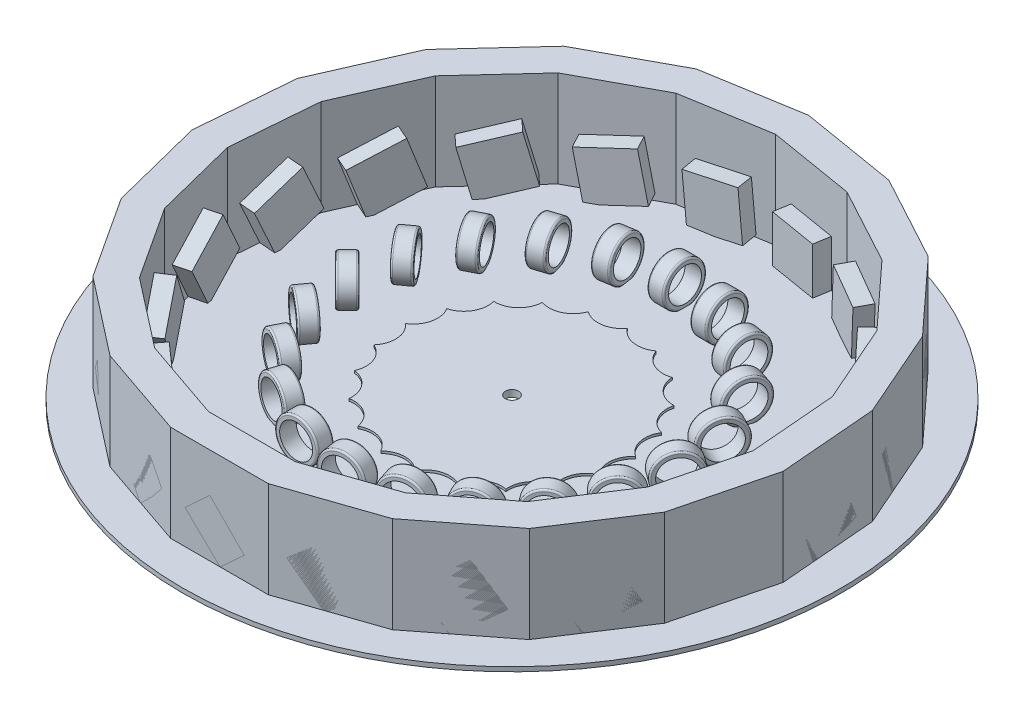
from build123d import *

# Parameters (mm, degrees)
SKETCH1_R                 = 100
SKETCH1_R_2               = 2.0000000000000018
BASE_PLATTER_DEPTH        = 0.75
SKETCH2_R                 = 2
INNER_DESIGN_DEPTH        = 1.3
CUBE_FACE_REFERENCE_DEPTH = 29.800000000000015
FIRST_CUBE_DEPTH          = 14.82
BOSS_EXTRUDE6_DEPTH       = 14.82
BOSS_EXTRUDE7_DEPTH       = 14.82
BOSS_EXTRUDE9_DEPTH       = 14.82
BOSS_EXTRUDE10_DEPTH      = 14.82
BOSS_EXTRUDE11_DEPTH      = 14.82
BOSS_EXTRUDE12_DEPTH      = 14.82
BOSS_EXTRUDE14_DEPTH      = 14.82
BOSS_EXTRUDE15_DEPTH      = 14.82
BOSS_EXTRUDE16_DEPTH      = 14.82
BOSS_EXTRUDE18_DEPTH      = 14.82
BOSS_EXTRUDE19_DEPTH      = 14.82
BOSS_EXTRUDE20_DEPTH      = 14.82
BOSS_EXTRUDE21_DEPTH      = 14.82
BOSS_EXTRUDE23_DEPTH      = 14.82
BOSS_EXTRUDE24_DEPTH      = 14.82
BOSS_EXTRUDE25_DEPTH      = 14.82
BOSS_EXTRUDE26_DEPTH      = 14.82
BOSS_EXTRUDE27_DEPTH      = 14.82
RINGS_DEPTH               = 13
SKETCH23_W                = 5.000000000000001
SKETCH23_H                = 13
RINGS_2_DEPTH             = 13
RINGS_3_DEPTH             = 13
RINGS_4_DEPTH             = 13
RINGS_5_DEPTH             = 13
RINGS_6_DEPTH             = 13
RINGS_7_DEPTH             = 13
RINGS_8_DEPTH             = 13
RINGS_9_DEPTH             = 13
RINGS_10_DEPTH            = 13
RINGS_11_DEPTH            = 13
RINGS_12_DEPTH            = 13
RINGS_13_DEPTH            = 13
RINGS_14_DEPTH            = 13
RINGS_15_DEPTH            = 13
RINGS_16_DEPTH            = 13
RINGS_17_DEPTH            = 13
RINGS_18_DEPTH            = 13
RINGS_19_DEPTH            = 13
RINGS_20_DEPTH            = 13
SKETCH26_R                = 4.999999999999997
CUT_EXTRUDE2_DEPTH        = 5
SKETCH27_R                = 4.999999999999997
CUT_EXTRUDE3_DEPTH        = 5
SKETCH28_R                = 4.999999999999997
CUT_EXTRUDE4_DEPTH        = 5
SKETCH29_R                = 4.999999999999997
CUT_EXTRUDE5_DEPTH        = 5
SKETCH30_R                = 4.999999999999997
CUT_EXTRUDE6_DEPTH        = 5
SKETCH31_R                = 4.999999999999997
CUT_EXTRUDE7_DEPTH        = 5
SKETCH32_R                = 4.999999999999997
CUT_EXTRUDE8_DEPTH        = 5
SKETCH33_R                = 5
CUT_EXTRUDE9_DEPTH        = 5
SKETCH34_R                = 4.999999999999998
CUT_EXTRUDE10_DEPTH       = 5
SKETCH35_R                = 4.999999999999998
CUT_EXTRUDE11_DEPTH       = 5
SKETCH36_R                = 5.000000000000003
CUT_EXTRUDE12_DEPTH       = 5
SKETCH37_R                = 5.0000000000000036
CUT_EXTRUDE13_DEPTH       = 5
SKETCH38_R                = 5
CUT_EXTRUDE14_DEPTH       = 5
SKETCH39_R                = 4.999999999999997
CUT_EXTRUDE15_DEPTH       = 5
SKETCH40_R                = 5
CUT_EXTRUDE16_DEPTH       = 5
SKETCH41_R                = 5
CUT_EXTRUDE17_DEPTH       = 5
SKETCH42_R                = 5.000000000000004
CUT_EXTRUDE18_DEPTH       = 5
SKETCH43_R                = 4.999999999999997
CUT_EXTRUDE19_DEPTH       = 5
SKETCH44_R                = 4.999999999999997
CUT_EXTRUDE20_DEPTH       = 5
SKETCH45_R                = 4.999999999999997
CUT_EXTRUDE21_DEPTH       = 5
SKETCH46_R                = 100
SKETCH46_R_2              = 2
BOSS_EXTRUDE29_DEPTH      = 0.6
FILLET1_R                 = 0.5


with BuildPart() as part:
    # Sketch1 → Base Platter (new body)
    with BuildSketch(Plane(origin=(0, 0, 0), x_dir=(1, 0, 0), z_dir=(0, 1, 0))):
        with Locations(Location((0, 0, 0), (0, 0, 270))):
            Circle(SKETCH1_R)
        with Locations(Location((0, 0, 0), (0, 0, 270))):
            Circle(SKETCH1_R_2, mode=Mode.SUBTRACT)
    extrude(amount=BASE_PLATTER_DEPTH)

    # Sketch2 → Inner Design (add)
    with BuildSketch(Plane(origin=(0, 0.75, 0), x_dir=(1, 0, 0), z_dir=(0, 1, 0))):
        with BuildLine():
            ThreePointArc((-19.716202032226768, 28.918357101059826), (-14.078808144855762, 29.234946351030235), (-10.316431104381639, 33.44504820251493))
            ThreePointArc((-10.316431104381639, 33.44504820251493), (-4.83617449051309, 32.085921261895884), (5.0307e-13, 35))
            ThreePointArc((5.0307e-13, 35), (4.836174490513928, 32.08592126189614), (10.31643110438215, 33.44504820251479))
            ThreePointArc((10.31643110438215, 33.44504820251479), (14.078808144856417, 29.234946351030885), (19.71620203222678, 28.91835710105985))
            ThreePointArc((19.71620203222678, 28.91835710105985), (22.07047791169635, 23.78631816142687), (27.36410188638106, 21.822143065055702))
            ThreePointArc((27.36410188638106, 21.822143065055702), (28.101088861385357, 16.224171218642454), (32.580581202547165, 12.786935852823857))
            ThreePointArc((32.580581202547165, 12.786935852823857), (31.634794746142994, 7.220435464478965), (34.902132901341325, 2.6155532755248734))
            ThreePointArc((34.902132901341325, 2.6155532755248734), (32.357610290695696, -2.4248676670626104), (34.12247692636385, -7.788232688470976))
            ThreePointArc((34.12247692636385, -7.788232688470976), (30.20531016188618, -11.854710665029186), (30.310889132455394, -17.499999999999975))
            ThreePointArc((30.310889132455394, -17.499999999999975), (25.369135671372735, -20.231210596867037), (23.806045821982213, -25.656815514043906))
            ThreePointArc((23.806045821982213, -25.656815514043906), (18.27880214583962, -26.810078683967895), (15.185930869114577, -31.533910376584657))
            ThreePointArc((15.185930869114577, -31.533910376584657), (9.564316834446679, -31.006753625905763), (5.21647931616615, -34.60907891787949))
            ThreePointArc((5.21647931616615, -34.60907891787949), (4.033e-14, -32.448342437284836), (-5.216479316166072, -34.60907891787949))
            ThreePointArc((-5.216479316166072, -34.60907891787949), (-9.56431683444661, -31.00675362590577), (-15.185930869114513, -31.533910376584664))
            ThreePointArc((-15.185930869114513, -31.533910376584664), (-18.278802145839563, -26.81007868396791), (-23.806045821982142, -25.656815514043938))
            ThreePointArc((-23.806045821982142, -25.656815514043938), (-25.36913567137266, -20.231210596867072), (-30.31088913245533, -17.500000000000007))
            ThreePointArc((-30.31088913245533, -17.500000000000007), (-30.205310161886135, -11.854710665029213), (-34.12247692636381, -7.788232688471002))
            ThreePointArc((-34.12247692636381, -7.788232688471002), (-32.35761029069565, -2.4248676670626423), (-34.90213290134129, 2.61555327552483))
            ThreePointArc((-34.90213290134129, 2.61555327552483), (-31.634794746142965, 7.220435464478924), (-32.580581202547144, 12.786935852823822))
            ThreePointArc((-32.580581202547144, 12.786935852823822), (-28.101088861385335, 16.22417121864242), (-27.364101886381032, 21.82214306505568))
            ThreePointArc((-27.364101886381032, 21.82214306505568), (-22.070477911696734, 23.786318161427094), (-19.716202032226768, 28.918357101059826))
        make_face()
        with Locations(Location((0, 0, 0), (0, 0, 270))):
            Circle(SKETCH2_R, mode=Mode.SUBTRACT)
    extrude(amount=INNER_DESIGN_DEPTH)



with BuildPart() as body_2:
    # Sketch3 → Cube Face Reference (new body)
    with BuildSketch(Plane(origin=(0, 0.75, 0), x_dir=(1, 0, 0), z_dir=(0, 1, 0))):
        Polygon((2.429e-14, 90.00000000000001), (-29.222952228421583, 85.12355175305713), (-55.27914414207012, 71.02264584567544), (-75.34498304362761, 49.22533423101844), (-87.24602393453976, 22.093693842671932), (-89.69260437060031, -7.432141092509979), (-82.4195993989552, -36.152588218767285), (-66.21515196058188, -60.95534144631672), (-42.8352653733366, -79.15263760858409), (-14.813513125265956, -88.7725173062451), (14.813513125266049, -88.7725173062451), (42.83526537333665, -79.1526376085841), (66.21515196058186, -60.95534144631677), (82.41959939895521, -36.152588218767285), (89.69260437060034, -7.4321410925099265), (87.24602393453978, 22.09369384267194), (75.34498304362766, 49.225334231018365), (55.279144142070145, 71.02264584567543), (29.22295222842154, 85.12355175305714), align=None)
        Polygon((-2.776e-14, 80), (-25.97595753637474, 75.66537933605076), (-49.13701701517347, 63.131240751711445), (-66.9733182610023, 43.755852649794136), (-77.55202127514646, 19.638838971263908), (-79.7267594405336, -6.606347637786583), (-73.26186613240458, -32.13563397223765), (-58.85791285385055, -54.182525730059325), (-38.075791442965865, -70.3579000965192), (-13.1675672224587, -78.90890427221787), (13.167567222458729, -78.90890427221785), (38.075791442965894, -70.35790009651919), (58.85791285385056, -54.18252573005931), (73.2618661324046, -32.135633972237585), (79.72675944053361, -6.6063476377865165), (77.55202127514646, 19.63883897126394), (66.9733182610023, 43.75585264979415), (49.13701701517345, 63.13124075171147), (25.975957536374658, 75.66537933605078), align=None, mode=Mode.SUBTRACT)
    extrude(amount=CUBE_FACE_REFERENCE_DEPTH)


with BuildPart() as body_3:
    # Sketch4 → First Cube (new body)
    with BuildSketch(Plane(origin=(14.611476114210753, 0, -87.56177587652863), x_dir=(-0.9863613034027224, 0, -0.1645945902807338), z_dir=(0.1645945902807338, 0, -0.9863613034027224))):
        Polygon((-7.407500000000001, 0.75), (7.407500000000001, 0.75), (7.4075, 15.57), (-7.407500000000001, 15.57), align=None)
    extrude(amount=-FIRST_CUBE_DEPTH)


with BuildPart() as body_4:
    # Sketch5 → Boss-Extrude6 (new body)
    with BuildSketch(Plane(origin=(42.25104818524584, 0, -78.0730987993663), x_dir=(-0.879473751206489, 0, -0.4759473930370738), z_dir=(0.4759473930370738, 0, -0.879473751206489))):
        Polygon((-6.7727781432294405, 0.7500000000000014), (7.996604043129404, 1.9738258998999674), (6.77277814322944, 16.743208086258814), (-7.996604043129407, 15.519382186358849), align=None)
    extrude(amount=-BOSS_EXTRUDE6_DEPTH)


with BuildPart() as body_5:
    # Sketch6 → Boss-Extrude7 (new body)
    with BuildSketch(Plane(origin=(65.31206359284887, 0, -60.123990038346946), x_dir=(-0.6772815716257411, 0, -0.7357239106731317), z_dir=(0.7357239106731317, 0, -0.6772815716257411))):
        Polygon((-6.0892913442339935, 0.7500000000000014), (-8.528583172194372, 15.367874516428367), (6.089291344233993, 17.807166344388747), (8.528583172194367, 3.1892918279603784), align=None)
    extrude(amount=-BOSS_EXTRUDE7_DEPTH)


with BuildPart() as body_6:
    # Sketch7 → Boss-Extrude9 (new body)
    with BuildSketch(Plane(origin=(81.29550348908376, 0, -35.659514036845174), x_dir=(-0.4016954246529692, 0, -0.9157733266550576), z_dir=(0.9157733266550576, 0, -0.4016954246529692))):
        Polygon((-5.36420851089717, 0.75), (-9.002303430323744, 15.116511941220898), (5.364208510897154, 18.754606860647467), (9.002303430323721, 4.388094919426563), align=None)
    extrude(amount=-BOSS_EXTRUDE9_DEPTH)


with BuildPart() as body_7:
    # Sketch8 → Boss-Extrude10 (new body)
    with BuildSketch(Plane(origin=(88.46931415257009, 0, -7.330776375081016), x_dir=(-0.08257934547233238, 0, -0.9965844930066698), z_dir=(0.99658449300667, 0, -0.0825793454723324))):
        Polygon((-4.602482694195054, 0.75), (-9.414528827808395, 14.767011522003433), (4.602482694195035, 19.579057655616772), (9.414528827808367, 5.56204613361332), align=None)
    extrude(amount=-BOSS_EXTRUDE10_DEPTH)


with BuildPart() as body_8:
    # Sketch9 → Boss-Extrude11 (new body)
    with BuildSketch(Plane(origin=(86.05610188477782, 0, 21.792364655638615), x_dir=(0.24548548714079937, 0, -0.9694002659393304), z_dir=(0.9694002659393305, 0, 0.2454854871407994))):
        Polygon((3.8093172538355304, 20.274886894384913), (-9.76244344719246, 14.32176070102799), (-3.55e-15, 10.51244344719246), align=None)
        Polygon((-3.55e-15, 10.51244344719246), (9.762443447192455, 6.703126193356926), (3.80931725383553, 20.274886894384913), align=None)
        Polygon((-8.9e-16, 10.512443447192458), (-3.809317253835532, 0.7500000000000014), (9.762443447192455, 6.703126193356926), align=None)
        Polygon((-9.76244344719246, 14.32176070102799), (-3.809317253835532, 0.7500000000000014), (-8.9e-16, 10.512443447192458), align=None)
    extrude(amount=-BOSS_EXTRUDE11_DEPTH)


with BuildPart() as body_9:
    # Sketch10 → Boss-Extrude12 (new body)
    with BuildSketch(Plane(origin=(74.3173756797686, 0, 48.553964832542015), x_dir=(0.5469481581224269, 0, -0.8371664782625287), z_dir=(0.8371664782625287, 0, 0.5469481581224269))):
        Polygon((-2.990130314035431, 0.7500000000000022), (-10.043670678844782, 13.783800992880217), (2.9901303140354316, 20.83734135768956), (10.043670678844778, 7.803540364809351), align=None)
    extrude(amount=-BOSS_EXTRUDE12_DEPTH)


with BuildPart() as body_10:
    # Sketch11 → Boss-Extrude14 (new body)
    with BuildSketch(Plane(origin=(54.52520866695933, 0, 70.05398952745043), x_dir=(0.7891405093963932, 0, -0.6142127126896683), z_dir=(0.6142127126896683, 0, 0.7891405093963932))):
        Polygon((-2.1505177522381356, 0.7499999999999873), (-10.256289455612528, 13.156807207850639), (2.1505177522381262, 21.26257891122503), (10.256289455612519, 8.855771703374375), align=None)
    extrude(amount=-BOSS_EXTRUDE14_DEPTH)


with BuildPart() as body_11:
    # Sketch12 → Boss-Extrude15 (new body)
    with BuildSketch(Plane(origin=(28.82438924930138, 0, 83.96257745741461), x_dir=(0.9458172417006347, 0, -0.3246994692046836), z_dir=(0.3246994692046836, 0, 0.9458172417006347))):
        Polygon((-1.296214973596898, 0.750000000000002), (-10.398847375657711, 12.445062349254595), (1.296214973596889, 21.547694751315415), (10.3988473756577, 9.852632402060808), align=None)
    extrude(amount=-BOSS_EXTRUDE15_DEPTH)


with BuildPart() as body_12:
    # Sketch13 → Boss-Extrude16 (new body)
    with BuildSketch(Plane.XY.offset(88.7725173062451)):
        Polygon((-0.43305773234114836, 0.75), (-10.470370623834645, 11.653428356175802), (0.43305773234115635, 21.690741247669298), (10.470370623834652, 10.787312891493496), align=None)
    extrude(amount=-BOSS_EXTRUDE16_DEPTH)


with BuildPart() as body_13:
    # Sketch14 → Boss-Extrude18 (new body)
    with BuildSketch(Plane(origin=(-28.824389249301376, 0, 83.9625774574146), x_dir=(0.9458172417006347, 0, 0.3246994692046836), z_dir=(-0.3246994692046836, 0, 0.9458172417006347))):
        Polygon((0.43305773234112277, 0.75), (-10.470370623834645, 10.787312891493528), (-0.43305773234111367, 21.690741247669294), (10.470370623834652, 11.65342835617576), align=None)
    extrude(amount=-BOSS_EXTRUDE18_DEPTH)


with BuildPart() as body_14:
    # Sketch15 → Boss-Extrude19 (new body)
    with BuildSketch(Plane(origin=(-54.52520866695927, 0, 70.05398952745043), x_dir=(0.7891405093963937, 0, 0.6142127126896679), z_dir=(-0.6142127126896679, 0, 0.7891405093963937))):
        Polygon((1.2962149735968547, 0.7499999999999877), (-10.398847375657716, 9.852632402060836), (-1.296214973596866, 21.547694751315408), (10.398847375657706, 12.445062349254552), align=None)
    extrude(amount=-BOSS_EXTRUDE19_DEPTH)


with BuildPart() as body_15:
    # Sketch16 → Boss-Extrude20 (new body)
    with BuildSketch(Plane(origin=(-74.3173756797686, 0, 48.55396483254203), x_dir=(0.5469481581224271, 0, 0.8371664782625285), z_dir=(-0.8371664782625284, 0, 0.546948158122427))):
        Polygon((2.150517752238108, 0.7500000000000014), (-10.256289455612531, 8.855771703374419), (-2.150517752238109, 21.26257891122506), (10.256289455612528, 13.156807207850639), align=None)
    extrude(amount=-BOSS_EXTRUDE20_DEPTH)


with BuildPart() as body_16:
    # Sketch17 → Boss-Extrude21 (new body)
    with BuildSketch(Plane(origin=(-86.05610188477776, 0, 21.7923646556386), x_dir=(0.24548548714079926, 0, 0.9694002659393304), z_dir=(-0.9694002659393305, 0, 0.2454854871407993))):
        Polygon((2.9901303140353144, 0.7500000000000024), (-10.04367067884482, 7.8035403648095), (-2.99013031403532, 20.83734135768963), (10.043670678844812, 13.783800992880135), align=None)
    extrude(amount=-BOSS_EXTRUDE21_DEPTH)


with BuildPart() as body_17:
    # Sketch18 → Boss-Extrude23 (new body)
    with BuildSketch(Plane(origin=(-88.46931415257004, 0, -7.330776375080999), x_dir=(-0.08257934547233221, 0, 0.9965844930066698), z_dir=(-0.99658449300667, 0, -0.08257934547233223))):
        Polygon((3.8093172538354323, 0.7500000000000026), (-9.762443447192487, 6.703126193357057), (-3.809317253835426, 20.274886894384984), (9.7624434471925, 14.321760701027925), align=None)
    extrude(amount=-BOSS_EXTRUDE23_DEPTH)


with BuildPart() as body_18:
    # Sketch19 → Boss-Extrude24 (new body)
    with BuildSketch(Plane(origin=(-81.29550348908374, 0, -35.65951403684516), x_dir=(-0.40169542465296904, 0, 0.9157733266550577), z_dir=(-0.9157733266550576, 0, -0.401695424652969))):
        Polygon((4.602482694194955, 0.750000000000002), (-9.414528827808432, 5.5620461336134746), (-4.602482694194958, 19.579057655616857), (9.414528827808429, 14.767011522003386), align=None)
    extrude(amount=-BOSS_EXTRUDE24_DEPTH)


with BuildPart() as body_19:
    # Sketch20 → Boss-Extrude25 (new body)
    with BuildSketch(Plane(origin=(-65.31206359284884, 0, -60.12399003834697), x_dir=(-0.6772815716257413, 0, 0.7357239106731314), z_dir=(-0.7357239106731314, 0, -0.6772815716257413))):
        Polygon((5.364208510897141, 0.7500000000000011), (-9.002303430323746, 4.388094919426602), (-5.364208510897142, 18.75460686064749), (9.002303430323746, 15.116511941220885), align=None)
    extrude(amount=-BOSS_EXTRUDE25_DEPTH)


with BuildPart() as body_20:
    # Sketch21 → Boss-Extrude26 (new body)
    with BuildSketch(Plane(origin=(-42.251048185245864, 0, -78.07309879936632), x_dir=(-0.8794737512064889, 0, 0.47594739303707395), z_dir=(-0.47594739303707395, 0, -0.8794737512064889))):
        Polygon((6.089291344233902, 0.7499999999999994), (-8.528583172194436, 3.1892918279605356), (-6.089291344233897, 17.807166344388875), (8.528583172194441, 15.367874516428337), align=None)
    extrude(amount=-BOSS_EXTRUDE26_DEPTH)


with BuildPart() as body_21:
    # Sketch22 → Boss-Extrude27 (new body)
    with BuildSketch(Plane(origin=(-14.611476114210745, 0, -87.5617758765286), x_dir=(-0.9863613034027224, 0, 0.16459459028073373), z_dir=(-0.16459459028073373, 0, -0.9863613034027224))):
        Polygon((6.7727781432294645, 0.7499999999999885), (-7.9966040431293814, 1.9738258998998928), (-6.7727781432294725, 16.743208086258747), (7.996604043129378, 15.519382186358838), align=None)
    extrude(amount=-BOSS_EXTRUDE27_DEPTH)


with BuildPart() as body_22:
    # Sketch23 → Rings (new body)
    with BuildSketch(Plane(origin=(0, 0.75, 0), x_dir=(1, 0, 0), z_dir=(0, 1, 0))):
        Polygon((12.950849718747364, 54.052825814757675), (12.950849718747378, 41.05282581475768), (17.950849718747378, 41.05282581475769), (17.950849718747364, 54.05282581475769), align=None)
    extrude(amount=RINGS_DEPTH)

    # Sketch28 → Cut-Extrude4 (cut)
    with BuildSketch(Plane(origin=(17.950849718747424, 0, -1.916e-14), x_dir=(-1.6e-15, 0, -1), z_dir=(1, 0, -1.6e-15))):
        with BuildLine():
            Line((47.552825814758314, 13.75), (41.05282581475766, 13.75))
            Line((41.05282581475766, 13.75), (41.05282581475766, 7.250000000000003))
            ThreePointArc((41.052825814757654, 7.250000000000001), (42.95663173704533, 11.846194077712795), (47.552825814758314, 13.75))
        make_face()
        with BuildLine():
            ThreePointArc((47.55282581475831, 0.7499999999999991), (42.95663173704533, 2.6538059222872104), (41.052825814757654, 7.250000000000001))
            Line((41.05282581475766, 7.250000000000003), (41.05282581475766, 0.75))
            Line((41.05282581475766, 0.75), (47.55282581475831, 0.75))
        make_face()
        with Locations((47.552825814757654, 7.25)):
            Circle(SKETCH28_R)
        with BuildLine():
            Line((54.052825814757654, 13.75), (47.552825814758314, 13.75))
            ThreePointArc((47.552825814758314, 13.75), (52.14901989247045, 11.846194077712326), (54.052825814757654, 7.25))
            Line((54.052825814757654, 7.25), (54.052825814757654, 13.75))
        make_face()
        with BuildLine():
            Line((54.052825814757654, 0.75), (54.052825814757654, 7.25))
            ThreePointArc((54.052825814757654, 7.249999999999998), (52.14901989247045, 2.653805922287672), (47.55282581475831, 0.7499999999999991))
            Line((47.55282581475831, 0.75), (54.052825814757654, 0.75))
        make_face()
    extrude(amount=-CUT_EXTRUDE4_DEPTH, mode=Mode.SUBTRACT)


with BuildPart() as body_23:
    # Sketch23 → Rings 2 (new body)
    with BuildSketch(Plane(origin=(0, 0.75, 0), x_dir=(1, 0, 0), z_dir=(0, 1, 0))):
        with Locations((-1.78e-15, 50.00000000000001)):
            Rectangle(SKETCH23_W, SKETCH23_H)
    extrude(amount=RINGS_2_DEPTH)

    # Sketch27 → Cut-Extrude3 (cut)
    with BuildSketch(Plane(origin=(2.4999999999999987, 0, 0), x_dir=(0, 0, -1), z_dir=(1, 0, 0))):
        with Locations((50, 7.25)):
            Circle(SKETCH27_R)
        with BuildLine():
            Line((50.00000000000066, 13.75), (43.50000000000001, 13.75))
            Line((43.50000000000001, 13.75), (43.50000000000001, 7.249999999999998))
            ThreePointArc((43.5, 7.250000000000001), (45.403805922287674, 11.846194077712795), (50.00000000000066, 13.75))
        make_face()
        with BuildLine():
            ThreePointArc((50.000000000000654, 0.7499999999999991), (45.403805922287674, 2.6538059222872104), (43.5, 7.250000000000001))
            Line((43.50000000000001, 7.249999999999998), (43.50000000000001, 0.75))
            Line((43.50000000000001, 0.75), (50.000000000000654, 0.75))
        make_face()
        with BuildLine():
            Line((56.5, 13.75), (50.00000000000066, 13.75))
            ThreePointArc((50.00000000000066, 13.75), (54.596194077712795, 11.846194077712326), (56.5, 7.25))
            Line((56.5, 7.25), (56.5, 13.75))
        make_face()
        with BuildLine():
            Line((56.5, 0.75), (56.5, 7.25))
            ThreePointArc((56.5, 7.249999999999998), (54.596194077712795, 2.653805922287672), (50.000000000000654, 0.7499999999999991))
            Line((50.000000000000654, 0.75), (56.5, 0.75))
        make_face()
    extrude(amount=-CUT_EXTRUDE3_DEPTH, mode=Mode.SUBTRACT)


with BuildPart() as body_24:
    # Sketch23 → Rings 3 (new body)
    with BuildSketch(Plane(origin=(0, 0.75, 0), x_dir=(1, 0, 0), z_dir=(0, 1, 0))):
        Polygon((27.93686578589736, 47.26191009521636), (32.87530748887305, 46.47973777001518), (30.84165944334997, 33.639789342278405), (25.903217740374274, 34.421961667479586), align=None)
    extrude(amount=RINGS_3_DEPTH)

    # Sketch29 → Cut-Extrude5 (cut)
    with BuildSketch(Plane(origin=(24.889277018173086, 0, 3.94207421060584), x_dir=(0.15643446504023656, 0, -0.9876883405951369), z_dir=(0.9876883405951368, 0, 0.15643446504023653))):
        with Locations((44.55032620941853, 7.25)):
            Circle(SKETCH29_R)
        with BuildLine():
            Line((44.55032620941919, 13.75), (38.050326209418536, 13.75))
            Line((38.050326209418536, 13.75), (38.050326209418536, 7.249999999999996))
            ThreePointArc((38.05032620941853, 7.250000000000001), (39.9541321317062, 11.846194077712795), (44.55032620941919, 13.75))
        make_face()
        with BuildLine():
            ThreePointArc((44.55032620941918, 0.7499999999999991), (39.9541321317062, 2.6538059222872104), (38.05032620941853, 7.250000000000001))
            Line((38.050326209418536, 7.249999999999996), (38.050326209418536, 0.75))
            Line((38.050326209418536, 0.75), (44.55032620941918, 0.75))
        make_face()
        with BuildLine():
            Line((51.05032620941852, 0.75), (51.05032620941853, 7.25))
            ThreePointArc((51.05032620941853, 7.249999999999998), (49.146520287131324, 2.653805922287672), (44.55032620941918, 0.7499999999999991))
            Line((44.55032620941918, 0.75), (51.05032620941852, 0.75))
        make_face()
        with BuildLine():
            Line((51.05032620941853, 13.75), (44.55032620941919, 13.75))
            ThreePointArc((44.55032620941919, 13.75), (49.146520287131324, 11.846194077712326), (51.05032620941853, 7.25))
            Line((51.05032620941853, 7.25), (51.05032620941853, 13.75))
        make_face()
    extrude(amount=-CUT_EXTRUDE5_DEPTH, mode=Mode.SUBTRACT)


with BuildPart() as body_25:
    # Sketch23 → Rings 4 (new body)
    with BuildSketch(Plane(origin=(0, 0.75, 0), x_dir=(1, 0, 0), z_dir=(0, 1, 0))):
        Polygon((40.08181889144664, 36.343672456479524), (36.06459796457236, 23.979937744642513), (40.81988054604812, 22.434852772767794), (44.837101472922406, 34.798587484604795), align=None)
    extrude(amount=RINGS_4_DEPTH)

    # Sketch30 → Cut-Extrude6 (cut)
    with BuildSketch(Plane(origin=(30.32849100948537, 0, 9.854324086004343), x_dir=(0.3090169943749453, 0, -0.9510565162951543), z_dir=(0.9510565162951544, 0, 0.3090169943749453))):
        with BuildLine():
            Line((40.45084971874796, 13.75), (33.9508497187473, 13.75))
            Line((33.9508497187473, 13.75), (33.9508497187473, 7.250000000000006))
            ThreePointArc((33.9508497187473, 7.250000000000001), (35.854655641034974, 11.846194077712795), (40.45084971874796, 13.75))
        make_face()
        with BuildLine():
            ThreePointArc((40.45084971874795, 0.7499999999999991), (35.85465564103497, 2.6538059222872104), (33.9508497187473, 7.250000000000001))
            Line((33.9508497187473, 7.250000000000006), (33.9508497187473, 0.75))
            Line((33.9508497187473, 0.75), (40.45084971874795, 0.75))
        make_face()
        with Locations((40.4508497187473, 7.25)):
            Circle(SKETCH30_R)
        with BuildLine():
            Line((46.9508497187473, 13.75), (40.45084971874796, 13.75))
            ThreePointArc((40.45084971874796, 13.75), (45.047043796460095, 11.846194077712326), (46.9508497187473, 7.25))
            Line((46.9508497187473, 7.25), (46.9508497187473, 13.75))
        make_face()
        with BuildLine():
            Line((46.9508497187473, 0.75), (46.9508497187473, 7.25))
            ThreePointArc((46.9508497187473, 7.249999999999998), (45.04704379646009, 2.653805922287672), (40.45084971874795, 0.7499999999999991))
            Line((40.45084971874795, 0.75), (46.9508497187473, 0.75))
        make_face()
    extrude(amount=-CUT_EXTRUDE6_DEPTH, mode=Mode.SUBTRACT)


with BuildPart() as body_26:
    # Sketch23 → Rings 5 (new body)
    with BuildSketch(Plane(origin=(0, 0.75, 0), x_dir=(1, 0, 0), z_dir=(0, 1, 0))):
        Polygon((48.276247752593804, 22.377368375320636), (42.37437125597971, 10.794283560871845), (46.82940387692156, 8.524331062174118), (52.73128037353565, 20.10741587662291), align=None)
    extrude(amount=RINGS_5_DEPTH)

    # Sketch31 → Cut-Extrude7 (cut)
    with BuildSketch(Plane(origin=(33.72935407722357, 0, 17.185964297354), x_dir=(0.4539904997395454, 0, -0.8910065241883687), z_dir=(0.8910065241883686, 0, 0.45399049973954536))):
        with BuildLine():
            Line((35.35533905932799, 13.75), (28.85533905932733, 13.75))
            Line((28.85533905932733, 13.75), (28.85533905932733, 7.25))
            ThreePointArc((28.855339059327328, 7.250000000000001), (30.759144981615, 11.846194077712795), (35.35533905932799, 13.75))
        make_face()
        with BuildLine():
            ThreePointArc((35.35533905932798, 0.7499999999999991), (30.759144981614998, 2.6538059222872104), (28.855339059327328, 7.250000000000001))
            Line((28.85533905932733, 7.25), (28.85533905932733, 0.75))
            Line((28.85533905932733, 0.75), (35.35533905932798, 0.75))
        make_face()
        with Locations((35.35533905932733, 7.25)):
            Circle(SKETCH31_R)
        with BuildLine():
            Line((41.855339059327335, 13.75), (35.35533905932799, 13.75))
            ThreePointArc((35.35533905932799, 13.75), (39.95153313704012, 11.846194077712326), (41.85533905932733, 7.25))
            Line((41.855339059327335, 7.25), (41.855339059327335, 13.75))
        make_face()
        with BuildLine():
            Line((41.85533905932733, 0.75), (41.855339059327335, 7.25))
            ThreePointArc((41.85533905932733, 7.249999999999998), (39.951533137040116, 2.653805922287672), (35.35533905932798, 0.7499999999999991))
            Line((35.35533905932798, 0.75), (41.85533905932733, 0.75))
        make_face()
    extrude(amount=-CUT_EXTRUDE7_DEPTH, mode=Mode.SUBTRACT)


with BuildPart() as body_27:
    # Sketch23 → Rings 6 (new body)
    with BuildSketch(Plane(origin=(0, 0.75, 0), x_dir=(1, 0, 0), z_dir=(0, 1, 0))):
        Polygon((51.79806165396369, 6.7280735941683485), (44.156853374161564, -3.789147332705984), (48.20193834603631, -6.728073594168339), (55.84314662583844, 3.7891473327059897), align=None)
    extrude(amount=RINGS_6_DEPTH)

    # Sketch32 → Cut-Extrude8 (cut)
    with BuildSketch(Plane(origin=(34.74796734531116, 0, 25.245876038109998), x_dir=(0.5877852522924715, 0, -0.8090169943749487), z_dir=(0.8090169943749487, 0, 0.5877852522924715))):
        with BuildLine():
            Line((29.389262614624226, 13.75), (22.889262614623572, 13.75))
            Line((22.889262614623572, 13.75), (22.889262614623572, 7.2500000000000036))
            ThreePointArc((22.889262614623565, 7.250000000000001), (24.793068536911242, 11.846194077712795), (29.389262614624226, 13.75))
        make_face()
        with BuildLine():
            ThreePointArc((29.38926261462421, 0.7499999999999991), (24.793068536911232, 2.653805922287213), (22.889262614623565, 7.250000000000001))
            Line((22.889262614623572, 7.2500000000000036), (22.889262614623572, 0.75))
            Line((22.889262614623572, 0.75), (29.389262614624215, 0.75))
        make_face()
        with Locations((29.389262614623565, 7.25)):
            Circle(SKETCH32_R)
        with BuildLine():
            Line((35.889262614623576, 13.75), (29.389262614624226, 13.75))
            ThreePointArc((29.389262614624226, 13.75), (33.985456692336356, 11.846194077712326), (35.88926261462357, 7.25))
            Line((35.889262614623576, 7.25), (35.889262614623576, 13.75))
        make_face()
        with BuildLine():
            Line((35.88926261462357, 0.75), (35.889262614623576, 7.25))
            ThreePointArc((35.88926261462357, 7.249999999999998), (33.98545669233635, 2.6538059222876678), (29.38926261462421, 0.7499999999999991))
            Line((29.389262614624215, 0.75), (35.88926261462357, 0.75))
        make_face()
    extrude(amount=-CUT_EXTRUDE8_DEPTH, mode=Mode.SUBTRACT)


with BuildPart() as body_28:
    # Sketch23 → Rings 7 (new body)
    with BuildSketch(Plane(origin=(0, 0.75, 0), x_dir=(1, 0, 0), z_dir=(0, 1, 0))):
        Polygon((50.38125293950386, -9.08688868806843), (41.188864784078774, -18.279276843493566), (44.72439869001152, -21.8148107494263), (53.91678684543661, -12.622422594001156), align=None)
    extrude(amount=RINGS_7_DEPTH)

    # Sketch33 → Cut-Extrude9 (cut)
    with BuildSketch(Plane(origin=(33.269604719719034, 0, 33.26960471971886), x_dir=(0.7071067811865459, 0, -0.7071067811865492), z_dir=(0.7071067811865492, 0, 0.7071067811865459))):
        with BuildLine():
            Line((22.69952498697788, 13.75), (16.19952498697722, 13.75))
            Line((16.19952498697722, 13.75), (16.19952498697722, 7.249999999999998))
            ThreePointArc((16.19952498697722, 7.250000000000001), (18.103330909264898, 11.846194077712795), (22.69952498697788, 13.75))
        make_face()
        with BuildLine():
            ThreePointArc((22.699524986977867, 0.7499999999999991), (18.103330909264887, 2.653805922287213), (16.19952498697722, 7.250000000000001))
            Line((16.19952498697722, 7.249999999999998), (16.19952498697722, 0.75))
            Line((16.19952498697722, 0.75), (22.69952498697787, 0.75))
        make_face()
        with Locations((22.69952498697722, 7.25)):
            Circle(SKETCH33_R)
        with BuildLine():
            Line((29.19952498697722, 13.75), (22.69952498697788, 13.75))
            ThreePointArc((22.69952498697788, 13.75), (27.295719064690015, 11.846194077712326), (29.19952498697722, 7.25))
            Line((29.19952498697722, 7.25), (29.19952498697722, 13.75))
        make_face()
        with BuildLine():
            Line((29.19952498697722, 0.75), (29.19952498697722, 7.25))
            ThreePointArc((29.19952498697722, 7.249999999999998), (27.295719064690008, 2.6538059222876678), (22.699524986977867, 0.7499999999999991))
            Line((22.69952498697787, 0.75), (29.19952498697722, 0.75))
        make_face()
    extrude(amount=-CUT_EXTRUDE9_DEPTH, mode=Mode.SUBTRACT)


with BuildPart() as body_29:
    # Sketch23 → Rings 8 (new body)
    with BuildSketch(Plane(origin=(0, 0.75, 0), x_dir=(1, 0, 0), z_dir=(0, 1, 0))):
        Polygon((44.23999705145333, -23.546115988785207), (33.72277612457904, -31.187324268587382), (36.661702386041426, -35.23240924046211), (47.178923312915714, -27.59120096065992), align=None)
    extrude(amount=RINGS_8_DEPTH)

    # Sketch34 → Cut-Extrude10 (cut)
    with BuildSketch(Plane(origin=(29.420312849478744, 0, 40.493586700628), x_dir=(0.8090169943749453, 0, -0.587785252292476), z_dir=(0.587785252292476, 0, 0.8090169943749453))):
        with BuildLine():
            ThreePointArc((15.450849718747847, 0.7499999999999964), (10.854655641034867, 2.6538059222872112), (8.950849718747198, 7.250000000000001))
            Line((8.950849718747206, 7.249999999999997), (8.950849718747206, 0.75))
            Line((8.950849718747206, 0.75), (15.450849718747847, 0.75))
        make_face()
        with BuildLine():
            Line((15.450849718747865, 13.75), (8.950849718747204, 13.75))
            Line((8.950849718747204, 13.75), (8.950849718747206, 7.249999999999997))
            ThreePointArc((8.950849718747198, 7.250000000000001), (10.854655641034874, 11.846194077712795), (15.450849718747865, 13.750000000000004))
        make_face()
        with Locations((15.450849718747202, 7.25)):
            Circle(SKETCH34_R)
        with BuildLine():
            Line((21.950849718747204, 13.75), (15.450849718747865, 13.75))
            ThreePointArc((15.450849718747865, 13.750000000000004), (20.04704379646, 11.846194077712326), (21.950849718747207, 7.25))
            Line((21.9508497187472, 7.25), (21.950849718747204, 13.75))
        make_face()
        with BuildLine():
            Line((21.9508497187472, 0.75), (21.9508497187472, 7.25))
            ThreePointArc((21.950849718747207, 7.249999999999998), (20.04704379645999, 2.653805922287666), (15.450849718747847, 0.7499999999999964))
            Line((15.450849718747847, 0.75), (21.9508497187472, 0.75))
        make_face()
    extrude(amount=-CUT_EXTRUDE10_DEPTH, mode=Mode.SUBTRACT)


with BuildPart() as body_30:
    # Sketch23 → Rings 9 (new body)
    with BuildSketch(Plane(origin=(0, 0.75, 0), x_dir=(1, 0, 0), z_dir=(0, 1, 0))):
        Polygon((24.732696456748155, -45.62930427752535), (36.31578127119692, -39.727427780911206), (34.04582877249917, -35.27239515996938), (22.462743958050414, -41.17427165658352), align=None)
    extrude(amount=RINGS_9_DEPTH)

    # Sketch35 → Cut-Extrude11 (cut)
    with BuildSketch(Plane(origin=(23.555032416034535, 0, 46.22935407722339), x_dir=(0.8910065241883667, 0, -0.4539904997395491), z_dir=(0.4539904997395491, 0, 0.8910065241883667))):
        with BuildLine():
            ThreePointArc((7.821723265308285, 0.7499999999999982), (3.2255291813504767, 2.6538059152358437), (1.3217232520114388, 7.249999993351919))
            Line((1.3217232520114406, 7.249999993351918), (1.3217232520114413, 0.75))
            Line((1.3217232520114413, 0.75), (7.821723265308285, 0.75))
        make_face()
        with BuildLine():
            Line((7.821723252012102, 13.75), (1.32172325201144, 13.75))
            Line((1.32172325201144, 13.75), (1.3217232520114406, 7.249999993351918))
            ThreePointArc((1.3217232520114388, 7.249999993351919), (3.2255291719486614, 11.846194075362341), (7.821723252012102, 13.750000000000002))
        make_face()
        with Locations((7.821723252011441, 7.25)):
            Circle(SKETCH35_R)
        with BuildLine():
            Line((14.32172325201144, 13.75), (7.821723252012102, 13.75))
            ThreePointArc((7.821723252012102, 13.750000000000002), (12.417917329724235, 11.846194077712326), (14.321723252011441, 7.25))
            Line((14.321723252011441, 7.25), (14.32172325201144, 13.75))
        make_face()
        with BuildLine():
            Line((14.321723252011441, 0.75), (14.321723252011441, 7.25))
            ThreePointArc((14.321723252011441, 7.249999999999998), (12.417917334425145, 2.653805926988583), (7.821723265308285, 0.7499999999999982))
            Line((7.821723265308285, 0.75), (14.321723252011441, 0.75))
        make_face()
    extrude(amount=-CUT_EXTRUDE11_DEPTH, mode=Mode.SUBTRACT)


with BuildPart() as body_31:
    # Sketch23 → Rings 10 (new body)
    with BuildSketch(Plane(origin=(0, 0.75, 0), x_dir=(1, 0, 0), z_dir=(0, 1, 0))):
        Polygon((10.041524848766262, -51.93907756893273), (22.40525956060324, -47.92185664205839), (20.860174588728487, -43.16657406058262), (8.49643987689151, -47.18379498745698), align=None)
    extrude(amount=RINGS_10_DEPTH)

    # Sketch36 → Cut-Extrude12 (cut)
    with BuildSketch(Plane(origin=(16.22339220468489, 0, 49.93046710549556), x_dir=(0.9510565162951524, 0, -0.30901699437495117), z_dir=(0.3090169943749511, 0, 0.9510565162951523))):
        with BuildLine():
            Line((6.6169e-13, 13.75), (-6.500000000000188, 13.75))
            Line((-6.500000000000188, 13.75), (-6.500000000000187, 7.249999999999998))
            ThreePointArc((-6.500000000000002, 7.250000000000001), (-4.596194077712328, 11.846194077712793), (6.6142e-13, 13.750000000000002))
        make_face()
        with BuildLine():
            ThreePointArc((-4.302674869e-08, 0.7499999999999982), (-4.596194092924813, 2.653805937499693), (-6.500000000000002, 7.250000000000001))
            Line((-6.500000000000187, 7.249999999999998), (-6.5000000000001865, 0.75))
            Line((-6.5000000000001865, 0.75), (-4.302674839e-08, 0.75))
        make_face()
        with Locations((0, 7.25)):
            Circle(SKETCH36_R)
        with BuildLine():
            Line((6.49999999999981, 0.75), (6.499999999999811, 7.25))
            ThreePointArc((6.500000000000002, 7.249999999999998), (4.596194062500307, 2.6538059070751867), (-4.302674869e-08, 0.7499999999999982))
            Line((-4.302674839e-08, 0.75), (6.49999999999981, 0.75))
        make_face()
        with BuildLine():
            Line((6.499999999999812, 13.75), (6.6169e-13, 13.75))
            ThreePointArc((6.6142e-13, 13.750000000000002), (4.596194077712794, 11.846194077712326), (6.500000000000002, 7.25))
            Line((6.499999999999811, 7.25), (6.499999999999812, 13.75))
        make_face()
    extrude(amount=-CUT_EXTRUDE12_DEPTH, mode=Mode.SUBTRACT)


with BuildPart() as body_32:
    # Sketch23 → Rings 11 (new body)
    with BuildSketch(Plane(origin=(0, 0.75, 0), x_dir=(1, 0, 0), z_dir=(0, 1, 0))):
        Polygon((-6.0288880512678, -53.48604487424937), (6.811060376468982, -51.45239682872633), (6.02888805126781, -46.51395512575064), (-6.811060376468971, -48.547603171273686), align=None)
    extrude(amount=RINGS_11_DEPTH)

    # Sketch37 → Cut-Extrude13 (cut)
    with BuildSketch(Plane(origin=(8.116511021974425, 0, 51.24563375886664), x_dir=(0.9876883405951373, 0, -0.156434465040234), z_dir=(0.156434465040234, 0, 0.9876883405951373))):
        with BuildLine():
            Line((-14.321723252011694, 13.75), (-14.321723252011694, 7.250000000000006))
            ThreePointArc((-14.321723252011697, 7.250000000000001), (-12.417917329724235, 11.846194077712582), (-7.821723252011638, 13.750000000000002))
            Line((-7.821723252011638, 13.750000000000002), (-14.321723252011694, 13.75))
        make_face()
        with BuildLine():
            Line((-14.321723252011694, 0.7499999999999983), (-7.821723245362948, 0.7499999999999992))
            ThreePointArc((-7.821723245362951, 0.7499999999999982), (-12.41791732737357, 2.6538059199367536), (-14.321723252011697, 7.250000000000001))
            Line((-14.321723252011694, 7.250000000000006), (-14.321723252011694, 0.7499999999999983))
        make_face()
        with Locations((-7.8217232520116955, 7.25)):
            Circle(SKETCH37_R)
        with BuildLine():
            ThreePointArc((-7.821723252011639, 13.750000000000002), (-3.2255291742991155, 11.84619407771254), (-1.3217232520116937, 7.25))
            Line((-1.3217232520116955, 7.25), (-1.3217232520116964, 13.750000000000004))
            Line((-1.3217232520116964, 13.750000000000004), (-7.821723252011638, 13.750000000000002))
        make_face()
        with BuildLine():
            Line((-7.821723245362948, 0.7499999999999992), (-1.3217232520116948, 0.75))
            Line((-1.3217232520116948, 0.75), (-1.3217232520116955, 7.25))
            ThreePointArc((-1.3217232520116937, 7.249999999999998), (-3.2255291719484473, 2.653805924638127), (-7.821723245362951, 0.7499999999999982))
        make_face()
    extrude(amount=-CUT_EXTRUDE13_DEPTH, mode=Mode.SUBTRACT)


with BuildPart() as body_33:
    # Sketch23 → Rings 12 (new body)
    with BuildSketch(Plane(origin=(0, 0.75, 0), x_dir=(1, 0, 0), z_dir=(0, 1, 0))):
        Polygon((-21.950849718747353, -50.0528258147577), (-8.950849718747357, -50.05282581475765), (-8.95084971874738, -45.05282581475765), (-21.950849718747378, -45.05282581475772), align=None)
    extrude(amount=RINGS_12_DEPTH)

    # Sketch38 → Cut-Extrude14 (cut)
    with BuildSketch(Plane.XY.offset(50.052825814757604)):
        with BuildLine():
            Line((-15.450849718746888, 13.75), (-21.950849718747563, 13.75))
            Line((-21.950849718747563, 13.75), (-21.950849718747563, 7.250000000000006))
            ThreePointArc((-21.950849718747563, 7.250000000000001), (-20.04704379645988, 11.846194077712799), (-15.450849718746888, 13.75))
        make_face()
        with BuildLine():
            ThreePointArc((-15.450849718746896, 0.7500000000000009), (-20.047043796459885, 2.653805922287205), (-21.950849718747563, 7.250000000000001))
            Line((-21.950849718747563, 7.250000000000006), (-21.950849718747563, 0.75))
            Line((-21.950849718747563, 0.75), (-15.450849718746896, 0.75))
        make_face()
        with Locations((-15.450849718747564, 7.25)):
            Circle(SKETCH38_R)
        with BuildLine():
            Line((-8.950849718747563, 13.75), (-15.450849718746888, 13.75))
            ThreePointArc((-15.450849718746888, 13.75), (-10.854655641034768, 11.846194077712319), (-8.950849718747566, 7.25))
            Line((-8.950849718747563, 7.25), (-8.950849718747563, 13.75))
        make_face()
        with BuildLine():
            Line((-8.950849718747564, 0.75), (-8.950849718747563, 7.25))
            ThreePointArc((-8.950849718747566, 7.249999999999998), (-10.854655641034771, 2.6538059222876775), (-15.450849718746896, 0.7500000000000009))
            Line((-15.450849718746896, 0.75), (-8.950849718747564, 0.75))
        make_face()
    extrude(amount=-CUT_EXTRUDE14_DEPTH, mode=Mode.SUBTRACT)


with BuildPart() as body_34:
    # Sketch23 → Rings 13 (new body)
    with BuildSketch(Plane(origin=(0, 0.75, 0), x_dir=(1, 0, 0), z_dir=(0, 1, 0))):
        Polygon((-36.343672456479524, -40.81988054604816), (-23.979937744642502, -44.83710147292241), (-22.434852772767787, -40.08181889144664), (-34.798587484604816, -36.064597964572386), align=None)
    extrude(amount=RINGS_13_DEPTH)

    # Sketch39 → Cut-Extrude15 (cut)
    with BuildSketch(Plane(origin=(-15.467173793248943, 0, 47.60306615011162), x_dir=(0.9510565162951552, 0, 0.3090169943749427), z_dir=(-0.3090169943749426, 0, 0.9510565162951551))):
        with BuildLine():
            Line((-15.450849718746932, 13.75), (-21.950849718747605, 13.75))
            Line((-21.950849718747605, 13.75), (-21.950849718747605, 7.250000000000001))
            ThreePointArc((-21.95084971874761, 7.250000000000001), (-20.047043796459928, 11.846194077712799), (-15.450849718746932, 13.75))
        make_face()
        with BuildLine():
            ThreePointArc((-15.450849718746941, 0.7500000000000009), (-20.04704379645993, 2.653805922287205), (-21.95084971874761, 7.250000000000001))
            Line((-21.950849718747605, 7.250000000000001), (-21.950849718747605, 0.75))
            Line((-21.950849718747605, 0.75), (-15.450849718746941, 0.75))
        make_face()
        with BuildLine():
            Line((-8.950849718747605, 13.75), (-15.450849718746932, 13.75))
            ThreePointArc((-15.450849718746932, 13.75), (-10.85465564103481, 11.846194077712319), (-8.950849718747609, 7.25))
            Line((-8.950849718747609, 7.25), (-8.950849718747605, 13.75))
        make_face()
        with Locations((-15.450849718747609, 7.25)):
            Circle(SKETCH39_R)
        with BuildLine():
            Line((-8.950849718747614, 0.75), (-8.950849718747609, 7.25))
            ThreePointArc((-8.950849718747609, 7.249999999999998), (-10.854655641034814, 2.6538059222876775), (-15.450849718746941, 0.7500000000000009))
            Line((-15.450849718746941, 0.75), (-8.950849718747614, 0.75))
        make_face()
    extrude(amount=-CUT_EXTRUDE15_DEPTH, mode=Mode.SUBTRACT)


with BuildPart() as body_35:
    # Sketch23 → Rings 14 (new body)
    with BuildSketch(Plane(origin=(0, 0.75, 0), x_dir=(1, 0, 0), z_dir=(0, 1, 0))):
        Polygon((-47.377368375320636, -28.66584067678756), (-35.794283560871826, -34.56771717340162), (-33.52433106217411, -30.11268455245976), (-45.10741587662292, -24.210808055845714), align=None)
    extrude(amount=RINGS_14_DEPTH)

    # Sketch40 → Cut-Extrude16 (cut)
    with BuildSketch(Plane(origin=(-21.36040110872232, 0, 41.92214761778279), x_dir=(0.8910065241883703, 0, 0.45399049973954203), z_dir=(-0.453990499739542, 0, 0.8910065241883702))):
        with BuildLine():
            Line((-22.699524986976915, 13.75), (-29.19952498697757, 13.75))
            Line((-29.19952498697757, 13.75), (-29.19952498697757, 7.249999999999997))
            ThreePointArc((-29.199524986977575, 7.250000000000001), (-27.295719064689898, 11.846194077712795), (-22.699524986976915, 13.75))
        make_face()
        with BuildLine():
            Line((-16.19952498697757, 13.75), (-22.699524986976915, 13.75))
            ThreePointArc((-22.699524986976915, 13.75), (-18.10333090926478, 11.846194077712326), (-16.199524986977575, 7.25))
            Line((-16.199524986977572, 7.25), (-16.19952498697757, 13.75))
        make_face()
        with Locations((-22.699524986977575, 7.25)):
            Circle(SKETCH40_R)
        with BuildLine():
            Line((-16.19952498697758, 0.75), (-16.199524986977572, 7.25))
            ThreePointArc((-16.199524986977575, 7.249999999999998), (-18.103330909264788, 2.6538059222876678), (-22.69952498697693, 0.7499999999999991))
            Line((-22.699524986976925, 0.75), (-16.19952498697758, 0.75))
        make_face()
        with BuildLine():
            ThreePointArc((-22.69952498697693, 0.7499999999999991), (-27.29571906468991, 2.653805922287213), (-29.199524986977575, 7.250000000000001))
            Line((-29.19952498697757, 7.249999999999997), (-29.19952498697757, 0.75))
            Line((-29.19952498697757, 0.75), (-22.699524986976925, 0.75))
        make_face()
    extrude(amount=-CUT_EXTRUDE16_DEPTH, mode=Mode.SUBTRACT)


with BuildPart() as body_36:
    # Sketch23 → Rings 15 (new body)
    with BuildSketch(Plane(origin=(0, 0.75, 0), x_dir=(1, 0, 0), z_dir=(0, 1, 0))):
        Polygon((-54.28089940892603, -13.652788064783714), (-43.76367848205167, -21.293996344585803), (-40.824752220589325, -17.248911372711042), (-51.34197314746369, -9.60770309290896), align=None)
    extrude(amount=RINGS_15_DEPTH)

    # Sketch41 → Cut-Extrude17 (cut)
    with BuildSketch(Plane(origin=(-25.24587603810973, 0, 34.747967345311075), x_dir=(0.809016994374951, 0, 0.5877852522924681), z_dir=(-0.5877852522924681, 0, 0.809016994374951))):
        with BuildLine():
            Line((-22.88926261462391, 13.75), (-29.389262614623274, 13.75))
            ThreePointArc((-29.389262614623274, 13.749999999999996), (-24.79306853691112, 11.846194077712335), (-22.889262614623906, 7.25))
            Line((-22.889262614623906, 7.25), (-22.88926261462391, 13.75))
        make_face()
        with BuildLine():
            Line((-29.389262614623274, 13.75), (-35.8892626146239, 13.75))
            Line((-35.8892626146239, 13.75), (-35.8892626146239, 7.2499999825950505))
            ThreePointArc((-35.8892626146239, 7.24999998259505), (-33.98545669848981, 11.8461940715592), (-29.389262614623274, 13.749999999999996))
        make_face()
        with Locations((-29.389262614623902, 7.25)):
            Circle(SKETCH41_R)
        with BuildLine():
            Line((-22.889262614623902, 0.75), (-22.889262614623906, 7.25))
            ThreePointArc((-22.889262614623906, 7.249999999999998), (-24.793068536911118, 2.6538059222876704), (-29.389262614623256, 0.7500000000000027))
            Line((-29.389262614623252, 0.75), (-22.889262614623902, 0.75))
        make_face()
        with BuildLine():
            ThreePointArc((-29.389262614623256, 0.7500000000000027), (-33.98545668618265, 2.653805916133636), (-35.8892626146239, 7.24999998259505))
            Line((-35.8892626146239, 7.2499999825950505), (-35.8892626146239, 0.75))
            Line((-35.8892626146239, 0.75), (-29.389262614623252, 0.75))
        make_face()
    extrude(amount=-CUT_EXTRUDE17_DEPTH, mode=Mode.SUBTRACT)


with BuildPart() as body_37:
    # Sketch23 → Rings 16 (new body)
    with BuildSketch(Plane(origin=(0, 0.75, 0), x_dir=(1, 0, 0), z_dir=(0, 1, 0))):
        Polygon((-56.36396103067895, 2.8284271247461383), (-47.17157287525377, -6.363961030678921), (-43.63603896932105, -2.8284271247461588), (-52.828427124746234, 6.363961030678902), align=None)
    extrude(amount=RINGS_16_DEPTH)

    # Sketch42 → Cut-Extrude18 (cut)
    with BuildSketch(Plane(origin=(-26.767766952966067, 0, 26.767766952966397), x_dir=(0.7071067811865516, 0, 0.7071067811865435), z_dir=(-0.7071067811865435, 0, 0.7071067811865516))):
        with BuildLine():
            Line((-35.35533905932691, 13.75), (-41.85533905932756, 13.75))
            Line((-41.85533905932756, 13.75), (-41.85533905932756, 7.249999999999998))
            ThreePointArc((-41.85533905932757, 7.250000000000001), (-39.951533137039895, 11.846194077712795), (-35.35533905932691, 13.75))
        make_face()
        with BuildLine():
            Line((-28.855339059327566, 13.75), (-35.35533905932691, 13.75))
            ThreePointArc((-35.35533905932691, 13.75), (-30.759144981614774, 11.846194077712326), (-28.85533905932757, 7.25))
            Line((-28.85533905932757, 7.25), (-28.855339059327566, 13.75))
        make_face()
        with Locations((-35.35533905932757, 7.25)):
            Circle(SKETCH42_R)
        with BuildLine():
            Line((-28.855339059327573, 0.75), (-28.85533905932757, 7.25))
            ThreePointArc((-28.85533905932757, 7.249999999999998), (-30.759144981614778, 2.653805922287672), (-35.355339059326916, 0.7499999999999991))
            Line((-35.355339059326916, 0.75), (-28.855339059327573, 0.75))
        make_face()
        with BuildLine():
            ThreePointArc((-35.355339059326916, 0.7499999999999991), (-39.9515331370399, 2.6538059222872104), (-41.85533905932757, 7.250000000000001))
            Line((-41.85533905932756, 7.249999999999998), (-41.85533905932756, 0.75))
            Line((-41.85533905932756, 0.75), (-35.355339059326916, 0.75))
        make_face()
    extrude(amount=-CUT_EXTRUDE18_DEPTH, mode=Mode.SUBTRACT)


with BuildPart() as body_38:
    # Sketch23 → Rings 17 (new body)
    with BuildSketch(Plane(origin=(0, 0.75, 0), x_dir=(1, 0, 0), z_dir=(0, 1, 0))):
        Polygon((-53.39597244059615, 19.2399970514533), (-45.75476416079394, 8.722776124579035), (-41.70967918891921, 11.661702386041432), (-49.35088746872143, 22.178923312915696), align=None)
    extrude(amount=RINGS_17_DEPTH)

    # Sketch43 → Cut-Extrude19 (cut)
    with BuildSketch(Plane(origin=(-25.798955393315918, 0, 18.744038271357525), x_dir=(0.5877852522924778, 0, 0.8090169943749441), z_dir=(-0.8090169943749442, 0, 0.5877852522924778))):
        with BuildLine():
            Line((-33.950849718747534, 0.75), (-33.950849718747534, 7.25))
            ThreePointArc((-33.950849718747534, 7.249999999999998), (-35.85465564103474, 2.653805922287672), (-40.45084971874688, 0.7499999999999991))
            Line((-40.45084971874688, 0.75), (-33.950849718747534, 0.75))
        make_face()
        with BuildLine():
            Line((-33.95084971874753, 13.75), (-40.45084971874687, 13.75))
            ThreePointArc((-40.45084971874687, 13.75), (-35.85465564103474, 11.846194077712326), (-33.950849718747534, 7.25))
            Line((-33.950849718747534, 7.25), (-33.95084971874753, 13.75))
        make_face()
        with Locations((-40.450849718747534, 7.25)):
            Circle(SKETCH43_R)
        with BuildLine():
            Line((-40.45084971874687, 13.75), (-46.95084971874752, 13.75))
            Line((-46.95084971874752, 13.75), (-46.95084971874752, 7.250000000000002))
            ThreePointArc((-46.950849718747534, 7.250000000000001), (-45.04704379645986, 11.846194077712795), (-40.45084971874687, 13.75))
        make_face()
        with BuildLine():
            ThreePointArc((-40.45084971874688, 0.7499999999999991), (-45.04704379645986, 2.6538059222872104), (-46.950849718747534, 7.250000000000001))
            Line((-46.95084971874752, 7.250000000000002), (-46.95084971874752, 0.75))
            Line((-46.95084971874752, 0.75), (-40.45084971874688, 0.75))
        make_face()
    extrude(amount=-CUT_EXTRUDE19_DEPTH, mode=Mode.SUBTRACT)


with BuildPart() as body_39:
    # Sketch23 → Rings 18 (new body)
    with BuildSketch(Plane(origin=(0, 0.75, 0), x_dir=(1, 0, 0), z_dir=(0, 1, 0))):
        Polygon((-45.629304277525385, 34.04582877249914), (-39.727427780911206, 22.462743958050392), (-35.27239515996938, 24.73269645674816), (-41.174271656583564, 36.315781271196904), align=None)
    extrude(amount=RINGS_18_DEPTH)

    # Sketch44 → Cut-Extrude20 (cut)
    with BuildSketch(Plane(origin=(-22.452941169844305, 0, 11.44034494203706), x_dir=(0.4539904997395526, 0, 0.891006524188365), z_dir=(-0.891006524188365, 0, 0.4539904997395526))):
        with BuildLine():
            ThreePointArc((-44.55032620941788, 0.7499999999999991), (-49.14652028713087, 2.6538059222872104), (-51.050326209418536, 7.250000000000001))
            Line((-51.050326209418536, 7.250000000000006), (-51.050326209418536, 0.75))
            Line((-51.050326209418536, 0.75), (-44.55032620941788, 0.75))
        make_face()
        with BuildLine():
            Line((-38.05032620941854, 0.75), (-38.05032620941854, 7.25))
            ThreePointArc((-38.050326209418536, 7.249999999999998), (-39.95413213170575, 2.653805922287672), (-44.55032620941788, 0.7499999999999991))
            Line((-44.55032620941788, 0.75), (-38.05032620941854, 0.75))
        make_face()
        with BuildLine():
            Line((-38.05032620941854, 13.75), (-44.550326209417875, 13.75))
            ThreePointArc((-44.550326209417875, 13.75), (-39.95413213170574, 11.846194077712326), (-38.050326209418536, 7.25))
            Line((-38.05032620941854, 7.25), (-38.05032620941854, 13.75))
        make_face()
        with Locations((-44.550326209418536, 7.25)):
            Circle(SKETCH44_R)
        with BuildLine():
            Line((-44.550326209417875, 13.75), (-51.050326209418536, 13.75))
            Line((-51.050326209418536, 13.75), (-51.050326209418536, 7.250000000000006))
            ThreePointArc((-51.050326209418536, 7.250000000000001), (-49.14652028713086, 11.846194077712795), (-44.550326209417875, 13.75))
        make_face()
    extrude(amount=-CUT_EXTRUDE20_DEPTH, mode=Mode.SUBTRACT)


with BuildPart() as body_40:
    # Sketch23 → Rings 19 (new body)
    with BuildSketch(Plane(origin=(0, 0.75, 0), x_dir=(1, 0, 0), z_dir=(0, 1, 0))):
        Polygon((-33.775514368798746, 45.860174588728476), (-29.75829344192434, 33.4964398768915), (-25.003010860448605, 35.04152484876627), (-29.02023178732299, 47.40525956060324), align=None)
    extrude(amount=RINGS_19_DEPTH)

    # Sketch45 → Cut-Extrude21 (cut)
    with BuildSketch(Plane(origin=(-17.072272598049373, 0, 5.547117626563703), x_dir=(0.30901699437495334, 0, 0.9510565162951518), z_dir=(-0.9510565162951518, 0, 0.30901699437495334))):
        with BuildLine():
            Line((-41.05282581475776, 0.75), (-41.05282581475777, 7.25))
            ThreePointArc((-41.05282581475777, 7.249999999999998), (-42.95663173704497, 2.653805922287672), (-47.552825814757114, 0.7499999999999991))
            Line((-47.552825814757114, 0.75), (-41.05282581475776, 0.75))
        make_face()
        with BuildLine():
            ThreePointArc((-47.552825814757114, 0.7499999999999991), (-52.14901989247009, 2.6538059222872104), (-54.05282581475777, 7.250000000000001))
            Line((-54.05282581475778, 7.250000000000001), (-54.05282581475778, 0.75))
            Line((-54.05282581475778, 0.75), (-47.552825814757114, 0.75))
        make_face()
        with Locations((-47.55282581475777, 7.25)):
            Circle(SKETCH45_R)
        with BuildLine():
            Line((-41.05282581475778, 13.75), (-47.55282581475711, 13.75))
            ThreePointArc((-47.55282581475711, 13.75), (-42.95663173704497, 11.846194077712326), (-41.05282581475777, 7.25))
            Line((-41.05282581475777, 7.25), (-41.05282581475778, 13.75))
        make_face()
        with BuildLine():
            Line((-47.55282581475711, 13.75), (-54.05282581475778, 13.75))
            Line((-54.05282581475778, 13.75), (-54.05282581475778, 7.250000000000001))
            ThreePointArc((-54.05282581475777, 7.250000000000001), (-52.14901989247009, 11.846194077712795), (-47.55282581475711, 13.75))
        make_face()
    extrude(amount=-CUT_EXTRUDE21_DEPTH, mode=Mode.SUBTRACT)


with BuildPart() as body_41:
    # Sketch23 → Rings 20 (new body)
    with BuildSketch(Plane(origin=(0, 0.75, 0), x_dir=(1, 0, 0), z_dir=(0, 1, 0))):
        Polygon((-18.936894592996772, 53.58171386602547), (-16.903246547473685, 40.741765438288695), (-11.964804844497976, 41.52393776348989), (-13.99845289002109, 54.36388619122667), align=None)
    extrude(amount=RINGS_20_DEPTH)

    # Sketch26 → Cut-Extrude2 (cut)
    with BuildSketch(Plane(origin=(-5.25620400788541, 0, 0.8325009300205627), x_dir=(-0.15643446504023803, 0, -0.9876883405951367), z_dir=(0.9876883405951365, 0, -0.156434465040238))):
        with Locations((49.384417029756946, 7.25)):
            Circle(SKETCH26_R)
        with BuildLine():
            Line((49.38441702975761, 13.75), (42.88441702975694, 13.75))
            Line((42.88441702975694, 13.75), (42.88441702975694, 7.250000000000003))
            ThreePointArc((42.884417029756946, 7.250000000000001), (44.78822295204462, 11.846194077712795), (49.38441702975761, 13.75))
        make_face()
        with BuildLine():
            Line((55.88441702975695, 13.75), (49.38441702975761, 13.75))
            ThreePointArc((49.38441702975761, 13.75), (53.98061110746974, 11.846194077712326), (55.884417029756946, 7.25))
            Line((55.88441702975695, 7.25), (55.88441702975695, 13.75))
        make_face()
        with BuildLine():
            Line((55.88441702975695, 0.7499999999999893), (55.88441702975695, 7.25))
            ThreePointArc((55.884417029756946, 7.249999999999998), (53.98061110746952, 2.6538059222874564), (49.38441702975699, 0.7499999999999991))
            Line((49.38441702975699, 0.7499999999999886), (55.88441702975695, 0.7499999999999886))
        make_face()
        with BuildLine():
            ThreePointArc((49.38441702975699, 0.7499999999999991), (44.7882229520444, 2.653805922287427), (42.884417029756946, 7.250000000000001))
            Line((42.88441702975694, 7.250000000000003), (42.88441702975694, 0.7499999999999893))
            Line((42.88441702975694, 0.7499999999999886), (49.38441702975699, 0.7499999999999886))
        make_face()
    extrude(amount=-CUT_EXTRUDE2_DEPTH, mode=Mode.SUBTRACT)


with BuildPart() as part_1:
    add(part.part)

    add(body_3.part)  # Boss-Extrude29 merges body 3

    add(body_4.part)  # Boss-Extrude29 merges body 4

    add(body_5.part)  # Boss-Extrude29 merges body 5

    add(body_6.part)  # Boss-Extrude29 merges body 6

    add(body_7.part)  # Boss-Extrude29 merges body 7

    add(body_8.part)  # Boss-Extrude29 merges body 8

    add(body_9.part)  # Boss-Extrude29 merges body 9

    add(body_10.part)  # Boss-Extrude29 merges body 10

    add(body_11.part)  # Boss-Extrude29 merges body 11

    add(body_12.part)  # Boss-Extrude29 merges body 12

    add(body_13.part)  # Boss-Extrude29 merges body 13

    add(body_14.part)  # Boss-Extrude29 merges body 14

    add(body_15.part)  # Boss-Extrude29 merges body 15

    add(body_16.part)  # Boss-Extrude29 merges body 16

    add(body_17.part)  # Boss-Extrude29 merges body 17

    add(body_18.part)  # Boss-Extrude29 merges body 18

    add(body_19.part)  # Boss-Extrude29 merges body 19

    add(body_20.part)  # Boss-Extrude29 merges body 20

    add(body_21.part)  # Boss-Extrude29 merges body 21

    add(body_41.part)  # Boss-Extrude29 merges body 41

    add(body_23.part)  # Boss-Extrude29 merges body 23

    add(body_22.part)  # Boss-Extrude29 merges body 22

    add(body_24.part)  # Boss-Extrude29 merges body 24

    add(body_25.part)  # Boss-Extrude29 merges body 25

    add(body_26.part)  # Boss-Extrude29 merges body 26

    add(body_27.part)  # Boss-Extrude29 merges body 27

    add(body_28.part)  # Boss-Extrude29 merges body 28

    add(body_29.part)  # Boss-Extrude29 merges body 29

    add(body_30.part)  # Boss-Extrude29 merges body 30

    add(body_31.part)  # Boss-Extrude29 merges body 31

    add(body_32.part)  # Boss-Extrude29 merges body 32

    add(body_33.part)  # Boss-Extrude29 merges body 33

    add(body_34.part)  # Boss-Extrude29 merges body 34

    add(body_35.part)  # Boss-Extrude29 merges body 35

    add(body_36.part)  # Boss-Extrude29 merges body 36

    add(body_37.part)  # Boss-Extrude29 merges body 37

    add(body_38.part)  # Boss-Extrude29 merges body 38

    add(body_39.part)  # Boss-Extrude29 merges body 39

    add(body_40.part)  # Boss-Extrude29 merges body 40
    # Sketch46 → Boss-Extrude29 (add)
    with BuildSketch(Plane(origin=(0, 0.75, 0), x_dir=(1, 0, 0), z_dir=(0, 1, 0))):
        with Locations(Location((0, 0, 0), (0, 0, 270))):
            Circle(SKETCH46_R)
        with Locations(Location((0, 0, 0), (0, 0, 270))):
            Circle(SKETCH46_R_2, mode=Mode.SUBTRACT)
    extrude(amount=BOSS_EXTRUDE29_DEPTH)

    # Fillet1
    fillet1_edges = [part_1.edges().sort_by_distance(p)[0] for p in [
        (-17.92007057023514, 13.75, -47.161739652157095),
        (-12.98162886725946, 13.75, -47.94391197735828),
        (-2.5000000000000013, 13.750000000000014, -50.00000000000001),
        (2.4999999999999987, 13.750000000000004, -49.99999999999999),
        (12.95084971874735, 13.750000000000004, -47.55282581475766),
        (17.95084971874735, 13.750000000000004, -47.55282581475767),
        (26.920041763135814, 13.75000000000001, -40.841935881347965),
        (31.858483466111505, 13.750000000000004, -40.059763556146784),
        (38.073208428009494, 13.75, -30.161805100561025),
        (42.82849100948526, 13.75, -28.6167201286863),
        (45.32530950428681, 13.75, -16.58582596809624),
        (49.78034212522866, 13.75, -14.315873469398515),
        (47.97745751406262, 13.75, -1.4694631307311545),
        (52.022542485937365, 13.75, 1.4694631307312016),
        (45.78505886179132, 13.75, 13.683082765781025),
        (49.320592767724065, 13.75, 17.218616671713754),
        (38.98138658801619, 13.750000000000004, 27.366720128686314),
        (41.92031284947858, 13.750000000000004, 31.411805100561043),
        (24.867926210512504, 8.646424004377213, 45.560401276453554),
        (22.597973711814756, 8.646424004377208, 41.10536865551172),
        (12.893311319351383, 12.726296020399271, 51.01247597518914),
        (11.34822634747663, 12.726296020399278, 46.25719339371338),
        (-5.8789847144587135, 8.646424004376927, 53.46230251814608),
        (-6.661157039659884, 8.646424004376927, 48.523860815170394),
        (-21.799077817988827, 8.646424004377227, 50.052825814757604),
        (-9.102621619505722, 8.646424004376568, 45.052825814757604),
        (-24.124281399849263, 8.646424004376566, 44.7902013763195),
        (-34.65424382939792, 8.64642400437723, 36.11149806117538),
        (-35.92951331463605, 8.646424004376577, 34.49881417232993),
        (-44.97218612285866, 8.64642400437723, 24.279711056917527),
        (-54.158113361943826, 8.646424004377215, 13.741997349761974),
        (-51.21918710048149, 8.646424004377213, 9.696912377887221),
        (-47.27889181547359, 8.64642400437657, 6.256642090459119),
        (-43.743357909540855, 8.646424004376549, 2.7211081845263294),
        (-45.84397344577211, 8.64642400437655, -8.845562171561149),
        (-41.79888847389739, 8.646424004376566, -11.784488433023517),
        (-45.560401276453625, 8.646424004377211, -33.910599018734835),
        (-41.1053686555118, 8.646424004377218, -36.1805515174326),
        (-33.72861427219574, 8.64642400437723, -45.71583093352157),
        (-28.973331690719977, 8.646424004377229, -47.26091590539634),
    ]]
    fillet(fillet1_edges, radius=FILLET1_R)


solid = Compound([body_2.part, part_1.part])
